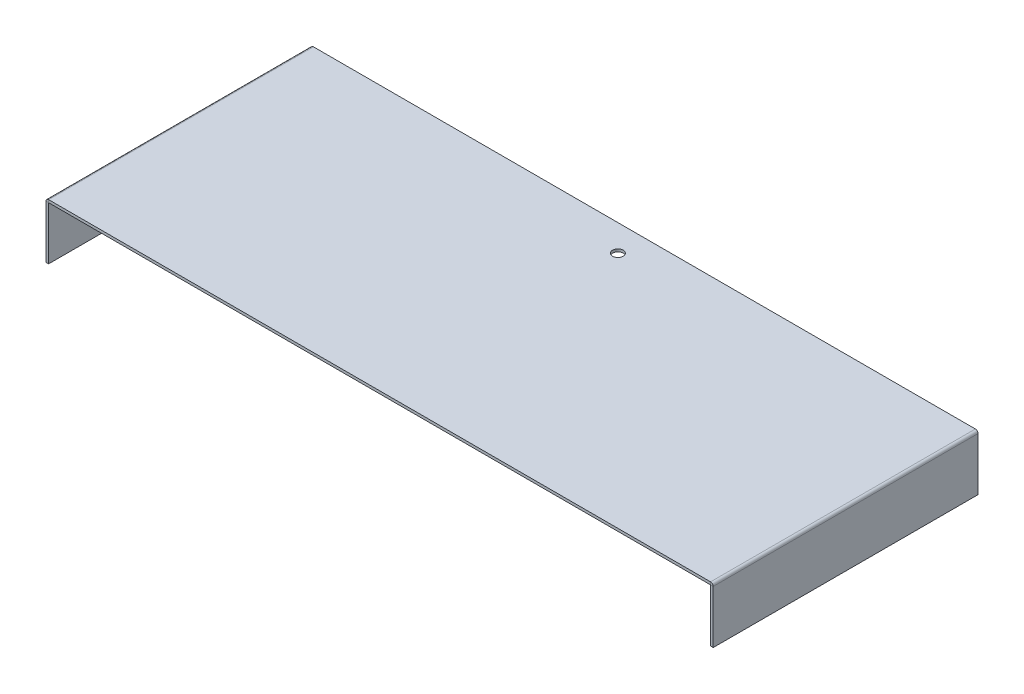
from build123d import *

# Parameters (mm, degrees)
T_LE_DE_BASE_PLI_E1_DEPTH = 100
ESQUISSE6_R               = 2
ENL_V_MAT_EXTRU_1_DEPTH   = 163.225152181


# Read off the part's stored shape, not the designer's step: Tôle de base pliée1
with BuildPart() as part:
    # Tôle de base pliée1 outline → Tôle de base pliée1 (new body)
    with BuildSketch(Plane.XY):
        with BuildLine():
            Line((-126, 0), (-126, -20))
            Line((-126, -20), (-125, -20))
            Line((-125, -20), (-125, 0))
            Line((-125, 0), (125, 0))
            Line((125, 0), (125, -20))
            Line((125, -20), (126, -20))
            Line((126, -20), (126, 0))
            ThreePointArc((126, 0), (125.707106781, 0.707106781), (125, 1))
            Line((125, 1), (-125, 1))
            ThreePointArc((-125, 1), (-125.707106781, 0.707106781), (-126, 0))
        make_face()
    extrude(amount=T_LE_DE_BASE_PLI_E1_DEPTH)

    # Esquisse6 → Enlèv. mat.-Extru.1 (cut, through all)
    with BuildSketch(Plane(origin=(0, 1, 0), x_dir=(1, 0, 0), z_dir=(0, 1, 0))):
        with Locations(Location((0, -10, 0), (0, 0, 180))):
            Circle(ESQUISSE6_R)
    extrude(amount=-ENL_V_MAT_EXTRU_1_DEPTH, mode=Mode.SUBTRACT)


solid = part.part
